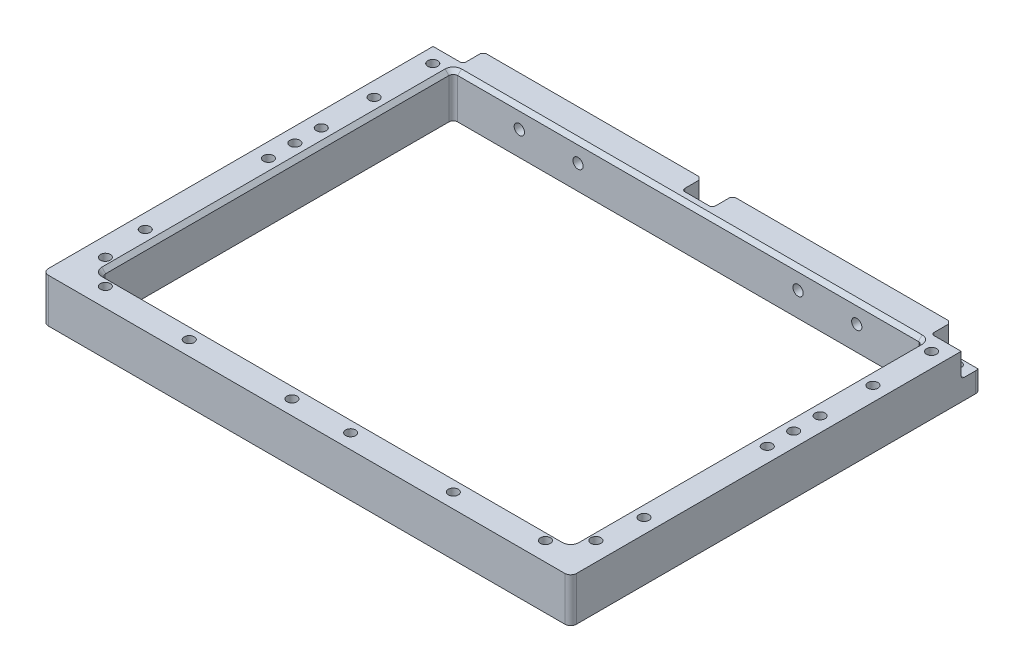
from build123d import *

# Parameters (mm, degrees)
SKETCH1_W                  = 228.6
SKETCH1_H                  = 177.8
SKETCH1_W_2                = 203.2
SKETCH1_H_2                = 152.4
BOSS_EXTRUDE1_DEPTH        = 19.05
SKETCH2_W                  = 12.954
SKETCH2_H                  = 10.414
SKETCH2_W_2                = 13.208
CUT_EXTRUDE1_DEPTH         = 8.763
SKETCH3_R                  = 2.159
CUT_EXTRUDE2_DEPTH         = 6.35
FILLET2_R                  = 1.27
CHAMFER1_SIZE              = 1.27
SKETCH4_R                  = 1.905
CUT_EXTRUDE3_DEPTH         = 7.112
SKETCH5_R                  = 2.159
CUT_EXTRUDE4_DEPTH         = 7.112
FILLET3_R                  = 1.905
SKETCH6_R                  = 2.159
MOTOR_MOUNT_HOLES_DEPTH    = 7.112
CHAMFER2_SIZE              = 1.651
SKETCH7_R                  = 2.159
REARBRACE_MOUNTHOLES_DEPTH = 7.112
SKETCH8_R                  = 2.159
SIDEBRACE_MOUNTHOLES_DEPTH = 7.112
SKETCH9_R                  = 2.159
BATTERYMOUNT_HOLES_DEPTH   = 7.112
FILLET4_R                  = 2.54
SKETCH10_R                 = 2.2225
CUT_EXTRUDE5_DEPTH         = 5.08


with BuildPart() as part:
    # Sketch1 → Boss-Extrude1 (new body)
    with BuildSketch(Plane(origin=(0, 0, 0), x_dir=(1, 0, 0), z_dir=(0, 1, 0))):
        Rectangle(SKETCH1_W, SKETCH1_H)
        Rectangle(SKETCH1_W_2, SKETCH1_H_2, mode=Mode.SUBTRACT)
    extrude(amount=BOSS_EXTRUDE1_DEPTH)

    # Sketch2 → Cut-Extrude1 (cut)
    with BuildSketch(Plane(origin=(0, 0, -88.9), x_dir=(-1, 0, 0), z_dir=(0, 0, -1))):
        with Locations((107.823, 13.843)):
            Rectangle(SKETCH2_W, SKETCH2_H)
        with Locations((0, 13.843)):
            Rectangle(SKETCH2_W_2, SKETCH2_H)
        with Locations((-107.823, 13.843)):
            Rectangle(SKETCH2_W, SKETCH2_H)
    extrude(amount=-CUT_EXTRUDE1_DEPTH, mode=Mode.SUBTRACT)

    # Sketch3 → Cut-Extrude2 (cut)
    with BuildSketch(Plane(origin=(0, 8.636, 0), x_dir=(1, 0, 0), z_dir=(0, 1, 0))):
        with Locations((-107.823, 84.5185)):
            Circle(SKETCH3_R)
        with Locations((0, 84.5185)):
            Circle(SKETCH3_R)
        with Locations((107.823, 84.5185)):
            Circle(SKETCH3_R)
    extrude(amount=-CUT_EXTRUDE2_DEPTH, mode=Mode.SUBTRACT)

    # Fillet2
    fillet2_edges = [part.edges().sort_by_distance(p)[0] for p in [
        (101.346, 8.636, -84.5185),
        (107.823, 8.636, -80.137),
        (-6.604, 8.636, -84.5185),
        (0, 8.636, -80.137),
        (6.604, 8.636, -84.5185),
        (-107.823, 8.636, -80.137),
        (-101.346, 8.636, -84.5185),
        (-101.346, 13.843, -80.137),
        (-6.604, 13.843, -80.137),
        (6.604, 13.843, -80.137),
        (101.346, 13.843, -80.137),
    ]]
    fillet(fillet2_edges, radius=FILLET2_R)

    # Chamfer1
    chamfer1_edges = [part.edges().sort_by_distance(p)[0] for p in [
        (-108.458, 8.636, -88.9),
        (-101.717974388, 9.007974388, -88.9),
        (-101.346, 14.478, -88.9),
        (-6.604, 14.478, -88.9),
        (-6.232025612, 9.007974388, -88.9),
        (0, 8.636, -88.9),
        (6.232025612, 9.007974388, -88.9),
        (6.604, 14.478, -88.9),
        (108.458, 8.636, -88.9),
        (101.717974388, 9.007974388, -88.9),
        (101.346, 14.478, -88.9),
    ]]
    chamfer(chamfer1_edges, length=CHAMFER1_SIZE)

    # Sketch4 → Cut-Extrude3 (cut)
    with BuildSketch(Plane(origin=(0, 0, -88.9), x_dir=(-1, 0, 0), z_dir=(0, 0, -1))):
        with Locations((-20.32, 9.525)):
            Circle(SKETCH4_R)
        with Locations((-81.28, 9.525)):
            Circle(SKETCH4_R)
        with Locations((81.28, 9.525)):
            Circle(SKETCH4_R)
        with Locations((20.32, 9.525)):
            Circle(SKETCH4_R)
    extrude(amount=-CUT_EXTRUDE3_DEPTH, mode=Mode.SUBTRACT)

    # Sketch5 → Cut-Extrude4 (cut)
    with BuildSketch(Plane(origin=(0, 19.05, 0), x_dir=(1, 0, 0), z_dir=(0, 1, 0))):
        with Locations((-95.25, -80.772)):
            Circle(SKETCH5_R)
        with Locations((-106.172, -69.85)):
            Circle(SKETCH5_R)
        with Locations((106.172, -69.85)):
            Circle(SKETCH5_R)
        with Locations((95.25, -80.772)):
            Circle(SKETCH5_R)
    extrude(amount=-CUT_EXTRUDE4_DEPTH, mode=Mode.SUBTRACT)

    # Fillet3
    fillet3_edges = [part.edges().sort_by_distance(p)[0] for p in [
        (-101.6, 9.525, 76.2),
        (101.6, 9.525, 76.2),
        (101.6, 9.525, -76.2),
        (-101.6, 9.525, -76.2),
    ]]
    fillet(fillet3_edges, radius=FILLET3_R)

    # Sketch6 → Motor_Mount_Holes (cut)
    with BuildSketch(Plane(origin=(0, 19.05, 0), x_dir=(1, 0, 0), z_dir=(0, 1, 0))):
        with Locations((107.95, -50.8)):
            Circle(SKETCH6_R)
        with Locations((107.95, 2.54)):
            Circle(SKETCH6_R)
        with Locations((107.95, 13.97)):
            Circle(SKETCH6_R)
        with Locations((107.95, 25.4)):
            Circle(SKETCH6_R)
        with Locations((-107.95, 25.4)):
            Circle(SKETCH6_R)
        with Locations((-107.95, 13.97)):
            Circle(SKETCH6_R)
        with Locations((-107.95, 2.54)):
            Circle(SKETCH6_R)
        with Locations((-107.95, -50.8)):
            Circle(SKETCH6_R)
    extrude(amount=-MOTOR_MOUNT_HOLES_DEPTH, mode=Mode.SUBTRACT)

    # Chamfer2
    chamfer2_edges = [part.edges().sort_by_distance(p)[0] for p in [
        (-101.6, 19.05, 0),
        (-101.042038418, 19.05, 75.642038418),
        (-101.042038418, 19.05, -75.642038418),
        (0, 19.05, 76.2),
        (0, 19.05, -76.2),
        (101.042038418, 19.05, 75.642038418),
        (101.042038418, 19.05, -75.642038418),
        (101.6, 19.05, 0),
    ]]
    chamfer(chamfer2_edges, length=CHAMFER2_SIZE)

    # Sketch7 → RearBrace_MountHoles (cut)
    with BuildSketch(Plane(origin=(0, 19.05, 0), x_dir=(1, 0, 0), z_dir=(0, 1, 0))):
        with Locations((-12.7, -82.55)):
            Circle(SKETCH7_R)
        with Locations((12.7, -82.55)):
            Circle(SKETCH7_R)
    extrude(amount=-REARBRACE_MOUNTHOLES_DEPTH, mode=Mode.SUBTRACT)

    # Sketch8 → SideBrace_MountHoles (cut)
    with BuildSketch(Plane(origin=(0, 19.05, 0), x_dir=(1, 0, 0), z_dir=(0, 1, 0))):
        with Locations((107.95, 73.66)):
            Circle(SKETCH8_R)
        with Locations((107.95, 48.26)):
            Circle(SKETCH8_R)
        with Locations((-107.95, 48.26)):
            Circle(SKETCH8_R)
        with Locations((-107.95, 73.66)):
            Circle(SKETCH8_R)
    extrude(amount=-SIDEBRACE_MOUNTHOLES_DEPTH, mode=Mode.SUBTRACT)

    # Sketch9 → BatteryMount_Holes (cut)
    with BuildSketch(Plane(origin=(0, 19.05, 0), x_dir=(1, 0, 0), z_dir=(0, 1, 0))):
        with Locations((-57.15, -82.55)):
            Circle(SKETCH9_R)
        with Locations((57.15, -82.55)):
            Circle(SKETCH9_R)
    extrude(amount=-BATTERYMOUNT_HOLES_DEPTH, mode=Mode.SUBTRACT)

    # Fillet4
    fillet4_edges = [part.edges().sort_by_distance(p)[0] for p in [
        (-114.3, 3.683, -88.9),
        (114.3, 3.683, -88.9),
        (-114.3, 9.525, 88.9),
        (114.3, 9.525, 88.9),
    ]]
    fillet(fillet4_edges, radius=FILLET4_R)

    # Sketch10 → Cut-Extrude5 (cut)
    with BuildSketch(Plane.XY.offset(-76.2)):
        with Locations((47.625, 10.541)):
            Circle(SKETCH10_R)
        with Locations((73.025, 10.541)):
            Circle(SKETCH10_R)
        with Locations((-73.025, 10.541)):
            Circle(SKETCH10_R)
        with Locations((-47.625, 10.541)):
            Circle(SKETCH10_R)
    extrude(amount=-CUT_EXTRUDE5_DEPTH, mode=Mode.SUBTRACT)


solid = part.part
